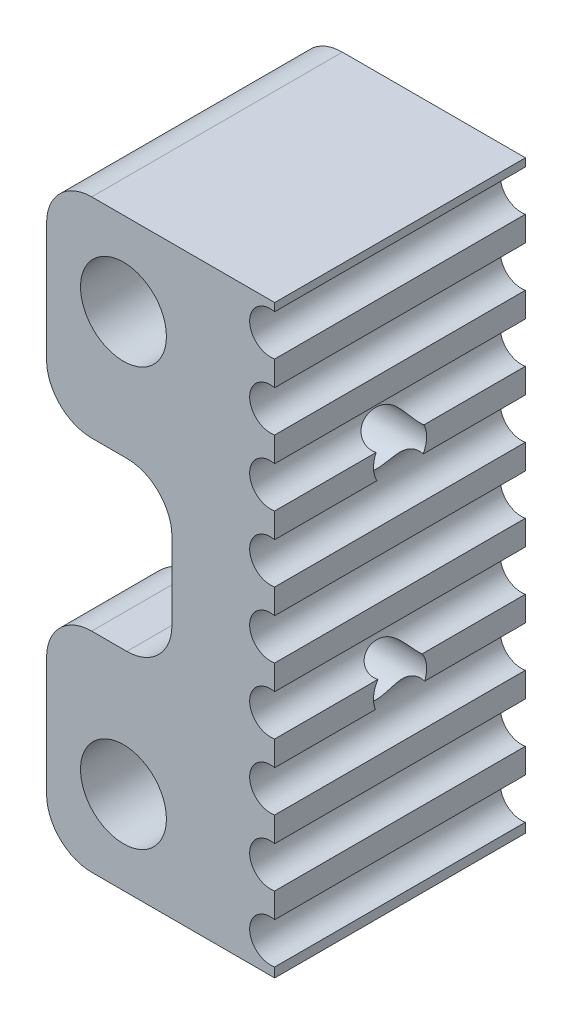
from build123d import *

# Parameters (mm, degrees)
BOSS_EXTRUDE1_DEPTH     = 19.05
F_1_4_CLEARANCE_HOLE1_D = 6.5278
F_10_32_TAPPED_HOLE1_D  = 4.0386
SKETCH6_R               = 1.5875
CUT_EXTRUDE1_DEPTH      = 52.373383773
LPATTERN1_COUNT         = 9
LPATTERN1_PITCH         = 5.00126
FILLET1_R               = 3.429


with BuildPart() as part:
    # Sketch1 → Boss-Extrude1 (new body)
    with BuildSketch(Plane.XY):
        Polygon((0, 0), (17.3355, 0), (17.3355, 44.45), (0, 44.45), (0, 28.575), (9.525, 28.575), (9.525, 15.875), (0, 15.875), align=None)
    extrude(amount=BOSS_EXTRUDE1_DEPTH)

    # 1/4 Clearance Hole1 (through all)
    with Locations(Plane.XY.offset(19.05)):
        with Locations((5.842, 38.1), (5.842, 6.35)):
            Hole(F_1_4_CLEARANCE_HOLE1_D / 2)

    # #10-32 Tapped Hole1 (through all)
    with Locations(Plane(origin=(17.3355, 0, 0), x_dir=(0, 0, -1), z_dir=(1, 0, 0))):
        with Locations((-9.525, 14.605), (-9.525, 29.845)):
            Hole(F_10_32_TAPPED_HOLE1_D / 2)

    # Sketch6 → Cut-Extrude1 (cut, symmetric)
    with BuildSketch(Plane.XY.offset(19.05)):
        with Locations((17.018, 2.28092)):
            Circle(SKETCH6_R)
    cut_extrude1 = extrude(amount=CUT_EXTRUDE1_DEPTH, both=True, mode=Mode.SUBTRACT)

    # LPattern1: Cut-Extrude1 ×9
    with Locations(*[(0, i * LPATTERN1_PITCH, 0) for i in range(1, LPATTERN1_COUNT)]):
        add(cut_extrude1, mode=Mode.SUBTRACT)

    # Fillet1
    # the kernel refuses this fillet: 3.429 mm, written as the material it adds along each edge
    with BuildSketch(Plane(origin=(9.525, 15.875, 2.522427543), x_dir=(-1, 0, 0), z_dir=(0, 0, 1))) as fillet1_piece_1_section:
        with BuildLine():
            CenterArc((FILLET1_R, -FILLET1_R), FILLET1_R, 90, 90)
            Line((0, -FILLET1_R), (0, 0))
            Line((0, 0), (FILLET1_R, 0))
        make_face()
    fillet1_piece_1 = extrude(amount=16.527572457, mode=Mode.PRIVATE)
    fillet1_piece_1 = fillet1_piece_1 - Plane(origin=(8.790805855, 14.605, 9.525), x_dir=(0, 0, 1), z_dir=(-1, 0, 0)) * Cylinder(2.0193, 47, mode=Mode.PRIVATE)
    add(fillet1_piece_1)
    with BuildSketch(Plane(origin=(9.525, 28.575, 2.522427543), x_dir=(0, -1, 0), z_dir=(0, 0, 1))) as fillet1_piece_2_section:
        with BuildLine():
            CenterArc((FILLET1_R, -FILLET1_R), FILLET1_R, 90, 90)
            Line((0, -FILLET1_R), (0, 0))
            Line((0, 0), (FILLET1_R, 0))
        make_face()
    fillet1_piece_2 = extrude(amount=16.527572457, mode=Mode.PRIVATE)
    fillet1_piece_2 = fillet1_piece_2 - Plane(origin=(8.790805812, 29.845, 9.525), x_dir=(0, 0, 1), z_dir=(-1, 0, 0)) * Cylinder(2.0193, 47, mode=Mode.PRIVATE)
    add(fillet1_piece_2)
    with BuildSketch(Plane(origin=(9.525, 15.875, 0), x_dir=(-1, 0, 0), z_dir=(0, 0, 1))) as fillet1_piece_3_section:
        with BuildLine():
            CenterArc((FILLET1_R, -FILLET1_R), FILLET1_R, 90, 90)
            Line((0, -FILLET1_R), (0, 0))
            Line((0, 0), (FILLET1_R, 0))
        make_face()
    fillet1_piece_3 = extrude(amount=16.527572457, mode=Mode.PRIVATE)
    fillet1_piece_3 = fillet1_piece_3 - Plane(origin=(8.790805857, 14.605, 9.525), x_dir=(0, 0, 1), z_dir=(-1, 0, 0)) * Cylinder(2.0193, 47, mode=Mode.PRIVATE)
    add(fillet1_piece_3)
    with BuildSketch(Plane(origin=(9.525, 28.575, 0), x_dir=(0, -1, 0), z_dir=(0, 0, 1))) as fillet1_piece_4_section:
        with BuildLine():
            CenterArc((FILLET1_R, -FILLET1_R), FILLET1_R, 90, 90)
            Line((0, -FILLET1_R), (0, 0))
            Line((0, 0), (FILLET1_R, 0))
        make_face()
    fillet1_piece_4 = extrude(amount=16.527572457, mode=Mode.PRIVATE)
    fillet1_piece_4 = fillet1_piece_4 - Plane(origin=(8.790805811, 29.845, 9.525), x_dir=(0, 0, 1), z_dir=(-1, 0, 0)) * Cylinder(2.0193, 47, mode=Mode.PRIVATE)
    add(fillet1_piece_4)
    # the kernel refuses this fillet: 3.429 mm, written as the material it takes off along each edge
    with BuildSketch(Plane(origin=(0, 15.875, 2.522427543), x_dir=(1, 0, 0), z_dir=(0, 0, 1)), Plane(origin=(0, 15.875, -8.5725), x_dir=(1, 0, 0), z_dir=(0, 0, 1))) as fillet1_2_piece_1:
        with BuildLine():
            CenterArc((FILLET1_R, -FILLET1_R), FILLET1_R, 90, 90)
            Line((0, -FILLET1_R), (0, 0))
            Line((0, 0), (FILLET1_R, 0))
        make_face()
    extrude(amount=25.100072457, mode=Mode.SUBTRACT)
    with BuildSketch(Plane(origin=(0, 28.575, 2.522427543), x_dir=(1, 0, 0), z_dir=(0, 0, 1)), Plane(origin=(0, 28.575, -8.5725), x_dir=(1, 0, 0), z_dir=(0, 0, 1))) as fillet1_2_piece_2:
        with BuildLine():
            CenterArc((FILLET1_R, FILLET1_R), FILLET1_R, 180, 90)
            Line((0, FILLET1_R), (0, 0))
            Line((0, 0), (FILLET1_R, 0))
        make_face()
    extrude(amount=25.100072457, mode=Mode.SUBTRACT)
    with BuildSketch(Plane(origin=(0, 44.45, -8.5725), x_dir=(0, -1, 0), z_dir=(0, 0, 1)), Plane(origin=(0, 0, -8.5725), x_dir=(1, 0, 0), z_dir=(0, 0, 1))) as fillet1_2_piece_3:
        with BuildLine():
            CenterArc((FILLET1_R, FILLET1_R), FILLET1_R, 180, 90)
            Line((0, FILLET1_R), (0, 0))
            Line((0, 0), (FILLET1_R, 0))
        make_face()
    extrude(amount=36.195, mode=Mode.SUBTRACT)


solid = part.part
